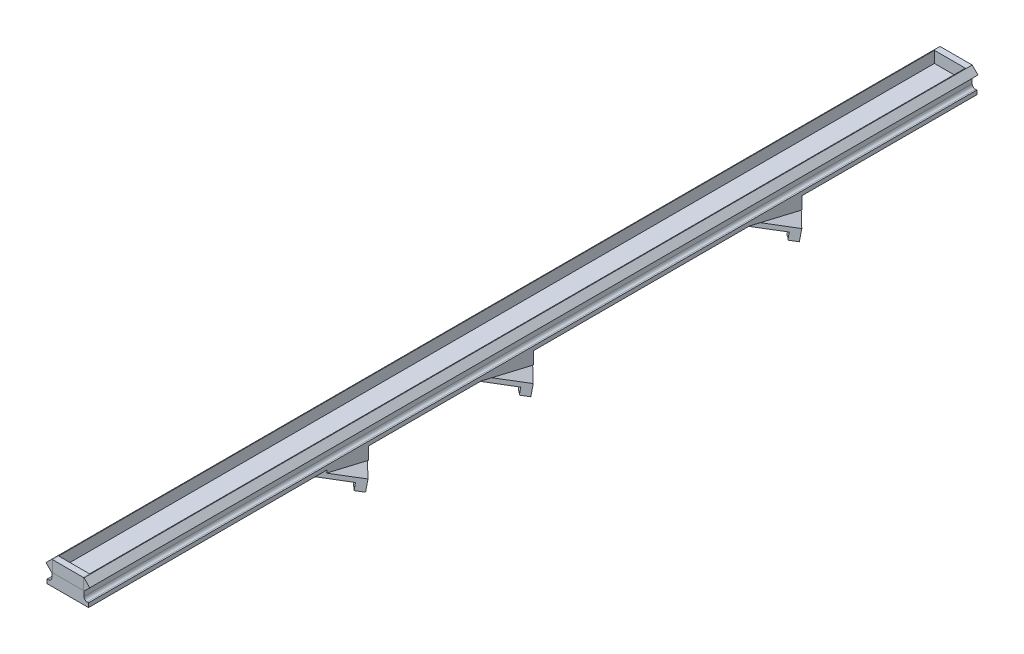
from build123d import *

# Parameters (mm, degrees)
EXTRUDE_1_DEPTH        = 230
EXTRUDE_4_DEPTH        = 20
EXTRUDE_5_DEPTH        = 7
CUT_EXTRUDE_2_DEPTH    = 183.949459984
SKETCH_13_R            = 0.8
CUT_EXTRUDE_3_DEPTH    = 185.21813585
CUT_EXTRUDE_START      = -19.466728686
CUT_EXTRUDE_4_DEPTH    = 17.054134169
PATTERN_LINEAR_1_COUNT = 2
PATTERN_LINEAR_1_PITCH = 80
EXTRUDE_START          = -110
EXTRUDE_6_DEPTH        = 110
EXTRUDE_7_DEPTH        = 320
SKETCH_14_W            = 15
SKETCH_14_H            = 5.5
CUT_EXTRUDE_5_DEPTH    = 431.660379744
SKETCH_15_W            = 15
SKETCH_15_H            = 5.5
EXTRUDE_8_DEPTH        = 3
SKETCH_16_W            = 15
SKETCH_16_H            = 5.5
EXTRUDE_9_DEPTH        = 3
PATTERN_LINEAR_2_COUNT = 2
PATTERN_LINEAR_2_PITCH = 210


# Read off the part's stored shape, not the designer's step: 切除-拉伸4
with BuildPart() as part:
    # 草图1 → 凸台-拉伸1 (new body)
    with BuildSketch(Plane.XY):
        with BuildLine():
            Line((10, 0), (-10, 0))
            Line((-10, 0), (-10, 2))
            Line((-10, 2), (-9.3, 2))
            ThreePointArc((-9.3, 2), (-8.239339828, 2.439339828), (-7.8, 3.5))
            Line((-7.8, 3.5), (-7.8, 5.8))
            Line((-7.8, 5.8), (-10.6, 8.6))
            Line((-10.6, 8.6), (-7.8, 11.4))
            Line((-7.8, 11.4), (7.8, 11.4))
            Line((7.8, 11.4), (10.6, 8.6))
            Line((10.6, 8.6), (7.8, 5.8))
            Line((7.8, 5.8), (7.8, 3.5))
            ThreePointArc((7.8, 3.5), (8.239339828, 2.439339828), (9.3, 2))
            Line((9.3, 2), (10, 2))
            Line((10, 2), (10, 0))
        make_face()
    extrude(amount=EXTRUDE_1_DEPTH)

    # 草图6 → 凸台-拉伸4 (add)
    with BuildSketch(Plane(origin=(10, 0, 0), x_dir=(0, 0, -1), z_dir=(1, 0, 0))):
        Polygon((-210, 0), (-184.538830434, -6), (-184.538830434, 0), align=None)
    extrude_4 = extrude(amount=-EXTRUDE_4_DEPTH)

    # 草图9 → 凸台-拉伸5 (add)
    with BuildSketch(Plane(origin=(0, -46.883568579, 11.04825176), x_dir=(1, 0, 0), z_dir=(0, -0.9733392406205545, 0.2293702741599314))):
        Polygon((-2.474873734, 211.474495246), (20.152543264, 188.847078248), (2.474873734, 171.169408719), (-20.152543264, 193.796825717), align=None)
    extrude_5 = extrude(amount=EXTRUDE_5_DEPTH)

    # 草图12 → 切除-拉伸2 (cut, through all)
    with BuildSketch(Plane(origin=(104.499810756, 23.969150243, 101.713766446), x_dir=(0.6708344230619809, 0.1538694755336464, -0.7254690629751898), z_dir=(0.7071067811865466, 0.16218927626110527, 0.6882547774377598))):
        Polygon((-157.172081563, -5.77097041), (-155.591240381, -1.027454714), (-132.82236504, -8.615492386), (-134.403206222, -13.359008082), align=None)
    cut_extrude_2 = extrude(amount=-CUT_EXTRUDE_2_DEPTH, mode=Mode.SUBTRACT)

    # 草图13 → 切除-拉伸3 (cut, through all)
    with BuildSketch(Plane(origin=(-84.347267492, 19.346755869, 82.098505289), x_dir=(-0.6708344230619789, 0.1538694755336449, -0.725469062975192), z_dir=(0.707106781186549, -0.16218927626110477, -0.6882547774377574))):
        with BuildLine():
            Line((-145.787643892, -9.564989246), (-145.186924243, -7.762453281))
            Line((-145.186924243, -7.762453281), (-149.562889479, -6.304103294))
            ThreePointArc((-149.562889479, -6.304103294), (-151.824611116, -6.709831328), (-153.390762633, -5.028412455))
            Line((-153.390762633, -5.028412455), (-157.045713483, -3.810350327))
            Line((-157.045713483, -3.810350327), (-157.646433132, -5.612886292))
            Line((-157.646433132, -5.612886292), (-145.787643892, -9.564989246))
        make_face()
        with BuildLine():
            Line((-140.810959007, -9.220803269), (-145.186924243, -7.762453281))
            Line((-145.186924243, -7.762453281), (-145.787643892, -9.564989246))
            Line((-145.787643892, -9.564989246), (-133.928854652, -13.5170922))
            Line((-133.928854652, -13.5170922), (-133.328135003, -11.714556236))
            Line((-133.328135003, -11.714556236), (-136.983085853, -10.496494108))
            ThreePointArc((-136.983085853, -10.496494108), (-139.24480749, -10.902222142), (-140.810959007, -9.220803269))
        make_face()
        with Locations(Location((-151.065807349, -4.432943794, 0), (0, 0, 351.029025291))):
            Circle(SKETCH_13_R)
        with Locations(Location((-138.486003723, -8.625334607, 0), (0, 0, 351.029025291))):
            Circle(SKETCH_13_R)
    cut_extrude_3 = extrude(amount=-CUT_EXTRUDE_3_DEPTH, mode=Mode.SUBTRACT)

    # 切除-拉伸4 outline → 切除-拉伸4 (cut)
    with BuildSketch(Plane(origin=(0, -53.696943263, 12.653843679), x_dir=(1, 0, 0), z_dir=(0, -0.9733392406205545, 0.2293702741599314)).offset(CUT_EXTRUDE_START)):
        Polygon((7.8, 201.199621512), (10, 198.999621512), (10.6, 198.399621512), (10.6, 225.840609701), (7.8, 226.482846468), (-7.8, 226.482846468), (-10.6, 225.840609701), (-10.6, 203.349368981), (-2.474873734, 211.474495246), align=None)
    extrude(amount=CUT_EXTRUDE_4_DEPTH, mode=Mode.SUBTRACT)

    # 阵列(线性)1: 凸台-拉伸4, 凸台-拉伸5, 切除-拉伸2, 切除-拉伸3 ×2
    with Locations(*[(0, 0, -i * PATTERN_LINEAR_1_PITCH) for i in range(1, PATTERN_LINEAR_1_COUNT)]):
        add(extrude_4)
        add(extrude_5)
        add(cut_extrude_2, mode=Mode.SUBTRACT)
        add(cut_extrude_3, mode=Mode.SUBTRACT)

    # 草图1<3> → 凸台-拉伸6 (add)
    with BuildSketch(Plane.XY.offset(EXTRUDE_START)):
        with BuildLine():
            Line((10, 0), (-10, 0))
            Line((-10, 0), (-10, 2))
            Line((-10, 2), (-9.3, 2))
            ThreePointArc((-9.3, 2), (-8.239339828, 2.439339828), (-7.8, 3.5))
            Line((-7.8, 3.5), (-7.8, 5.8))
            Line((-7.8, 5.8), (-10.6, 8.6))
            Line((-10.6, 8.6), (-7.8, 11.4))
            Line((-7.8, 11.4), (7.8, 11.4))
            Line((7.8, 11.4), (10.6, 8.6))
            Line((10.6, 8.6), (7.8, 5.8))
            Line((7.8, 5.8), (7.8, 3.5))
            ThreePointArc((7.8, 3.5), (8.239339828, 2.439339828), (9.3, 2))
            Line((9.3, 2), (10, 2))
            Line((10, 2), (10, 0))
        make_face()
    extrude(amount=EXTRUDE_6_DEPTH)

    # 草图1<4> → 凸台-拉伸7 (add)
    with BuildSketch(Plane.XY):
        with BuildLine():
            Line((10, 0), (-10, 0))
            Line((-10, 0), (-10, 2))
            Line((-10, 2), (-9.3, 2))
            ThreePointArc((-9.3, 2), (-8.239339828, 2.439339828), (-7.8, 3.5))
            Line((-7.8, 3.5), (-7.8, 5.8))
            Line((-7.8, 5.8), (-10.6, 8.6))
            Line((-10.6, 8.6), (-7.8, 11.4))
            Line((-7.8, 11.4), (7.8, 11.4))
            Line((7.8, 11.4), (10.6, 8.6))
            Line((10.6, 8.6), (7.8, 5.8))
            Line((7.8, 5.8), (7.8, 3.5))
            ThreePointArc((7.8, 3.5), (8.239339828, 2.439339828), (9.3, 2))
            Line((9.3, 2), (10, 2))
            Line((10, 2), (10, 0))
        make_face()
    extrude(amount=EXTRUDE_7_DEPTH)

    # 草图14 → 切除-拉伸5 (cut, through all)
    with BuildSketch(Plane.XY.offset(320)):
        with Locations((0, 8.65)):
            Rectangle(SKETCH_14_W, SKETCH_14_H)
    extrude(amount=-CUT_EXTRUDE_5_DEPTH, mode=Mode.SUBTRACT)

    # 草图15 → 凸台-拉伸8 (add)
    with BuildSketch(Plane(origin=(0, 0, -110), x_dir=(-1, 0, 0), z_dir=(0, 0, -1))):
        with Locations((0, 8.65)):
            Rectangle(SKETCH_15_W, SKETCH_15_H)
    extrude(amount=-EXTRUDE_8_DEPTH)

    # 阵列(线性)2: 凸台-拉伸4, 凸台-拉伸5, 切除-拉伸2, 切除-拉伸3 ×2
    with Locations(*[(0, 0, -i * PATTERN_LINEAR_2_PITCH) for i in range(1, PATTERN_LINEAR_2_COUNT)]):
        add(extrude_4)
        add(extrude_5)
        add(cut_extrude_2, mode=Mode.SUBTRACT)
        add(cut_extrude_3, mode=Mode.SUBTRACT)


with BuildPart() as body_2:
    # 草图16 → 凸台-拉伸9 (new body)
    with BuildSketch(Plane.XY.offset(320)):
        with Locations((0, 8.65)):
            Rectangle(SKETCH_16_W, SKETCH_16_H)
    extrude(amount=-EXTRUDE_9_DEPTH)


solid = Compound([part.part, body_2.part])
